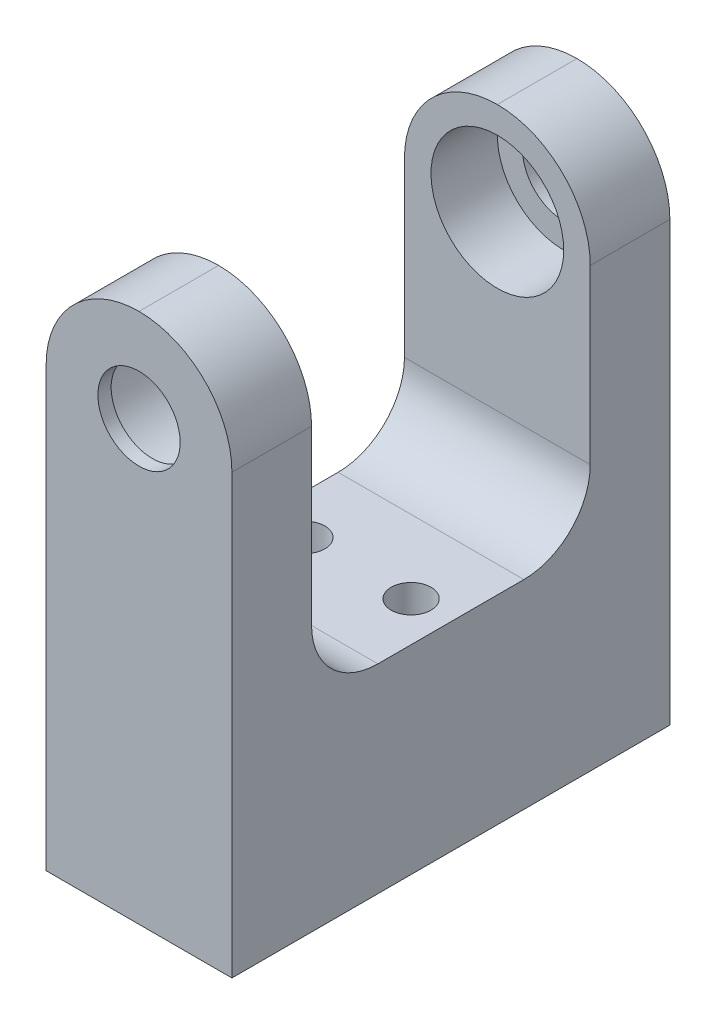
from build123d import *

# Parameters (mm, degrees)
EXTRUDE_1_DEPTH     = 14
FILLET_1_R          = 7
CUT_EXTRUDE_START   = -1
SKETCH_7_R          = 5
CUT_EXTRUDE_1_DEPTH = 31
SKETCH_8_R          = 3.1
CUT_EXTRUDE_2_DEPTH = 35
CUT_EXTRUDE_START_2 = 2
SKETCH_10_R         = 1.5
CUT_EXTRUDE_3_DEPTH = 20


with BuildPart() as part:
    # 草图4 → 凸台-拉伸1 (new body)
    with BuildSketch(Plane(origin=(0, 0, 0), x_dir=(0, 0, -1), z_dir=(1, 0, 0))):
        with BuildLine():
            Line((0, 0), (16.5, 0))
            Line((16.5, 0), (16.5, 40))
            Line((16.5, 40), (10.5, 40))
            Line((10.5, 40), (10.5, 20))
            ThreePointArc((10.5, 20), (9.035533906, 16.464466094), (5.5, 15))
            Line((5.5, 15), (-5.5, 15))
            ThreePointArc((-5.5, 15), (-9.035533906, 16.464466094), (-10.5, 20))
            Line((-10.5, 20), (-10.5, 40))
            Line((-10.5, 40), (-16.5, 40))
            Line((-16.5, 40), (-16.5, 0))
            Line((-16.5, 0), (0, 0))
        make_face()
    extrude(amount=EXTRUDE_1_DEPTH)

    # 圆角1
    fillet_1_edges = [part.edges().sort_by_distance(p)[0] for p in [
        (0, 40, 13.5),
        (0, 40, -13.5),
        (14, 40, -13.5),
        (14, 40, 13.5),
    ]]
    fillet(fillet_1_edges, radius=FILLET_1_R - 0.0001)  # a hair under: the kernel refuses the full size

    # 草图7 → 切除-拉伸1 (cut)
    with BuildSketch(Plane.XY.offset(16.5).offset(CUT_EXTRUDE_START)):
        with Locations((7, 33)):
            Circle(SKETCH_7_R)
    extrude(amount=-CUT_EXTRUDE_1_DEPTH, mode=Mode.SUBTRACT)

    # 草图8 → 切除-拉伸2 (cut)
    with BuildSketch(Plane.XY.offset(16.5)):
        with Locations((7, 33)):
            Circle(SKETCH_8_R)
    extrude(amount=-CUT_EXTRUDE_2_DEPTH, mode=Mode.SUBTRACT)

    # 草图10 → 切除-拉伸3 (cut)
    with BuildSketch(Plane(origin=(0, 15, 0), x_dir=(1, 0, 0), z_dir=(0, 1, 0)).offset(CUT_EXTRUDE_START_2)):
        with Locations(Location((3, 0, 0), (0, 0, 270))):
            Circle(SKETCH_10_R)
        with Locations(Location((11, 0, 0), (0, 0, 270))):
            Circle(SKETCH_10_R)
    extrude(amount=-CUT_EXTRUDE_3_DEPTH, mode=Mode.SUBTRACT)


solid = part.part
